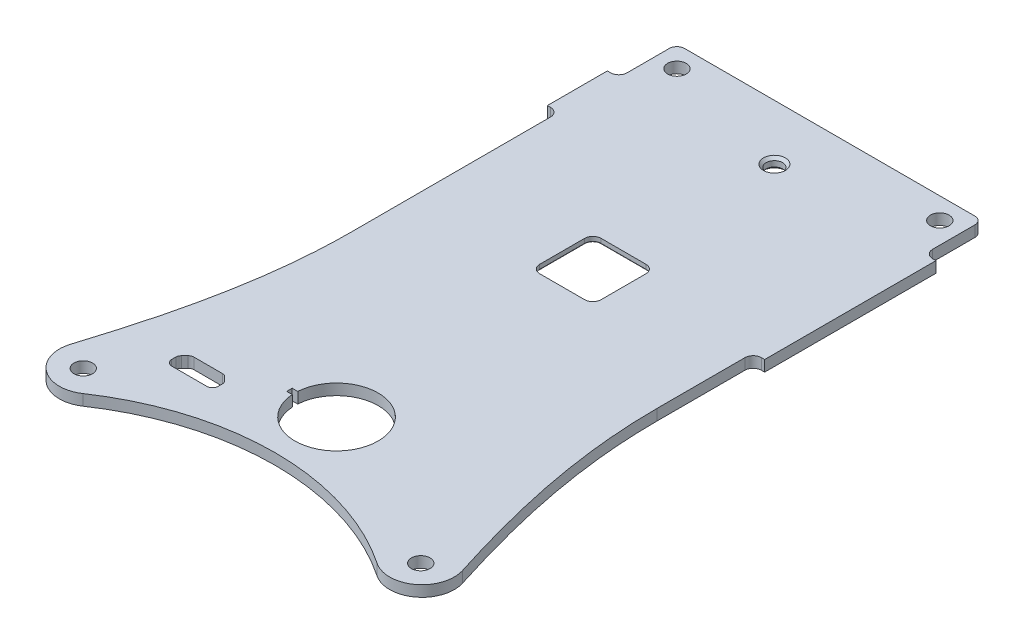
from build123d import *

# Parameters (mm, degrees)
VERT_ROD_W_VTULKA_1_START = 28
VERT_ROD_W_VTULKA_1_DEPTH = 2
HOLE_WIZARD_M32_D         = 3.4
HOLE_WIZARD_M32_DEPTH     = 2
HOLE_WIZARD_M32_TIP       = 1.021463052
HOLE_WIZARD_M33_D         = 3.4
HOLE_WIZARD_M33_DEPTH     = 2
HOLE_WIZARD_M33_TIP       = 1.021463052
HOLE_WIZARD_M34_D         = 3.4
HOLE_WIZARD_M34_DEPTH     = 2
HOLE_WIZARD_M34_TIP       = 1.021463052
HOLE_WIZARD_M35_D         = 3.4
HOLE_WIZARD_M35_DEPTH     = 2
HOLE_WIZARD_M35_TIP       = 1.021463052
HOLE_WIZARD_M36_D         = 3.4
HOLE_WIZARD_M36_DEPTH     = 2
HOLE_WIZARD_M36_TIP       = 1.021463052
HOLE_WIZARD_M37_D         = 3.4
HOLE_WIZARD_M37_DEPTH     = 2
HOLE_WIZARD_M37_TIP       = 1.021463052
HOLE_WIZARD_M38_D         = 3.4
HOLE_WIZARD_M38_DEPTH     = 2
HOLE_WIZARD_M38_TIP       = 1.021463052
HOLE_WIZARD_M39_D         = 3.4
HOLE_WIZARD_M39_DEPTH     = 2
HOLE_WIZARD_M39_TIP       = 1.021463052
HOLE_WIZARD_M310_D        = 3.4
HOLE_WIZARD_M310_DEPTH    = 2
HOLE_WIZARD_M310_TIP      = 1.021463052
HOLE_WIZARD_M311_D        = 3.4
HOLE_WIZARD_M311_DEPTH    = 2
HOLE_WIZARD_M311_TIP      = 1.021463052
SKETCH_25_W               = 2.1
SKETCH_25_H               = 31.28
EXTRUDE_1_DEPTH           = 2
HOLE_WIZARD_M313_D        = 3.4
HOLE_WIZARD_M313_DEPTH    = 2
HOLE_WIZARD_M313_TIP      = 1.021463052
HOLE_WIZARD_M314_D        = 3.4
HOLE_WIZARD_M314_DEPTH    = 2
HOLE_WIZARD_M314_TIP      = 1.021463052
HOLE_WIZARD_M315_D        = 3.4
HOLE_WIZARD_M315_DEPTH    = 2
HOLE_WIZARD_M315_TIP      = 1.021463052
HOLE_WIZARD_M316_D        = 3.4
HOLE_WIZARD_M316_DEPTH    = 2
HOLE_WIZARD_M316_TIP      = 1.021463052
HOLE_WIZARD_M317_D        = 3.4
HOLE_WIZARD_M317_DEPTH    = 2
HOLE_WIZARD_M317_TIP      = 1.021463052
HOLE_WIZARD_M318_D        = 3.4
HOLE_WIZARD_M318_DEPTH    = 2
HOLE_WIZARD_M318_TIP      = 1.021463052
HOLE_WIZARD_M319_D        = 3.4
HOLE_WIZARD_M319_DEPTH    = 2
HOLE_WIZARD_M319_TIP      = 1.021463052
HOLE_WIZARD_M320_D        = 3.4
HOLE_WIZARD_M320_DEPTH    = 2
HOLE_WIZARD_M320_TIP      = 1.021463052
HOLE_WIZARD_M321_D        = 3.4
HOLE_WIZARD_M321_DEPTH    = 2
HOLE_WIZARD_M321_TIP      = 1.021463052
HOLE_WIZARD_M323_D        = 3.4
HOLE_WIZARD_M323_DEPTH    = 2
HOLE_WIZARD_M323_TIP      = 1.021463052
HOLE_WIZARD_M324_D        = 3.4
HOLE_WIZARD_M324_DEPTH    = 2
HOLE_WIZARD_M324_TIP      = 1.021463052
HOLE_WIZARD_M325_D        = 3.4
HOLE_WIZARD_M325_DEPTH    = 2
HOLE_WIZARD_M325_TIP      = 1.021463052
HOLE_WIZARD_M326_D        = 3.4
HOLE_WIZARD_M326_DEPTH    = 2
HOLE_WIZARD_M326_TIP      = 1.021463052
HOLE_WIZARD_M327_D        = 3.4
HOLE_WIZARD_M327_DEPTH    = 2
HOLE_WIZARD_M327_TIP      = 1.021463052
HOLE_WIZARD_M328_D        = 3.4
HOLE_WIZARD_M328_DEPTH    = 2
HOLE_WIZARD_M328_TIP      = 1.021463052
HOLE_WIZARD_M329_D        = 3.4
HOLE_WIZARD_M329_DEPTH    = 2
HOLE_WIZARD_M329_TIP      = 1.021463052
FILLET_1_R                = 1.5
HOLE_WIZARD_M330_D        = 3.4
HOLE_WIZARD_M330_DEPTH    = 2
HOLE_WIZARD_M330_TIP      = 1.021463052
HOLE_WIZARD_M331_D        = 3.4
HOLE_WIZARD_M331_DEPTH    = 2
HOLE_WIZARD_M331_TIP      = 1.021463052
HOLE_WIZARD_M332_D        = 3.4
HOLE_WIZARD_M332_DEPTH    = 2
HOLE_WIZARD_M332_TIP      = 1.021463052
HOLE_WIZARD_M333_D        = 3.4
HOLE_WIZARD_M333_DEPTH    = 2
HOLE_WIZARD_M333_TIP      = 1.021463052
HOLE_WIZARD_M334_D        = 3.4
HOLE_WIZARD_M334_DEPTH    = 2
HOLE_WIZARD_M334_TIP      = 1.021463052
CUT_EXTRUDE_2_DEPTH       = 2
HOLE_WIZARD_M335_D        = 3.4
HOLE_WIZARD_M335_DEPTH    = 2
HOLE_WIZARD_M335_TIP      = 1.021463052
SKETCH_76_W               = 2.1
SKETCH_76_H               = 10.96
EXTRUDE_2_DEPTH           = 2
FILLET_2_R                = 1.5
HOLE_WIZARD_M336_D        = 3.4
HOLE_WIZARD_M336_DEPTH    = 2
HOLE_WIZARD_M336_TIP      = 1.021463052
HOLE_WIZARD_M337_D        = 3.4
HOLE_WIZARD_M337_DEPTH    = 2
HOLE_WIZARD_M337_TIP      = 1.021463052
HOLE_WIZARD_M338_D        = 3.4
HOLE_WIZARD_M338_DEPTH    = 2
HOLE_WIZARD_M338_TIP      = 1.021463052
HOLE_WIZARD_M339_D        = 3.4
HOLE_WIZARD_M339_DEPTH    = 2
HOLE_WIZARD_M339_TIP      = 1.021463052
HOLE_WIZARD_M340_D        = 3.4
HOLE_WIZARD_M340_DEPTH    = 2
HOLE_WIZARD_M340_TIP      = 1.021463052
HOLE_WIZARD_M341_D        = 3.4
HOLE_WIZARD_M341_DEPTH    = 2
HOLE_WIZARD_M341_TIP      = 1.021463052
HOLE_WIZARD_M342_D        = 3.4
HOLE_WIZARD_M342_DEPTH    = 2
HOLE_WIZARD_M342_TIP      = 1.021463052
HOLE_WIZARD_M343_D        = 3.4
HOLE_WIZARD_M343_DEPTH    = 2
HOLE_WIZARD_M343_TIP      = 1.021463052
HOLE_WIZARD_M344_D        = 3.4
HOLE_WIZARD_M344_DEPTH    = 2
HOLE_WIZARD_M344_TIP      = 1.021463052
HOLE_WIZARD_M345_D        = 3.4
HOLE_WIZARD_M345_DEPTH    = 2
HOLE_WIZARD_M345_TIP      = 1.021463052
HOLE_WIZARD_M346_D        = 3.4
HOLE_WIZARD_M346_DEPTH    = 2
HOLE_WIZARD_M346_TIP      = 1.021463052
HOLE_WIZARD_M347_D        = 3.4
HOLE_WIZARD_M347_DEPTH    = 2
HOLE_WIZARD_M347_TIP      = 1.021463052
HOLE_WIZARD_M348_D        = 3.4
HOLE_WIZARD_M348_DEPTH    = 2
HOLE_WIZARD_M348_TIP      = 1.021463052
HOLE_WIZARD_M349_D        = 3.4
HOLE_WIZARD_M349_DEPTH    = 2
HOLE_WIZARD_M349_TIP      = 1.021463052
HOLE_WIZARD_M350_D        = 3.4
HOLE_WIZARD_M350_DEPTH    = 2
HOLE_WIZARD_M350_TIP      = 1.021463052
HOLE_WIZARD_M351_D        = 3.4
HOLE_WIZARD_M351_DEPTH    = 2
HOLE_WIZARD_M351_TIP      = 1.021463052
HOLE_WIZARD_M352_D        = 3.4
HOLE_WIZARD_M352_DEPTH    = 2
HOLE_WIZARD_M352_TIP      = 1.021463052
HOLE_WIZARD_M353_D        = 3.4
HOLE_WIZARD_M353_DEPTH    = 2
HOLE_WIZARD_M353_TIP      = 1.021463052
HOLE_WIZARD_M354_D        = 3.4
HOLE_WIZARD_M354_DEPTH    = 2
HOLE_WIZARD_M354_TIP      = 1.021463052
HOLE_WIZARD_M355_D        = 3.4
HOLE_WIZARD_M355_DEPTH    = 2
HOLE_WIZARD_M355_TIP      = 1.021463052
HOLE_WIZARD_M356_D        = 3.4
HOLE_WIZARD_M356_DEPTH    = 2
HOLE_WIZARD_M356_TIP      = 1.021463052
HOLE_WIZARD_M357_D        = 3.4
HOLE_WIZARD_M357_DEPTH    = 2
HOLE_WIZARD_M357_TIP      = 1.021463052
HOLE_WIZARD_M358_D        = 3.4
HOLE_WIZARD_M358_DEPTH    = 2
HOLE_WIZARD_M358_TIP      = 1.021463052
SKETCH_123_R              = 7.6
CUT_EXTRUDE_3_DEPTH       = 121.787440724
SKETCH_124_W              = 2
SKETCH_124_H              = 1
CUT_EXTRUDE_4_DEPTH       = 121.787440724
CUT_EXTRUDE_5_DEPTH       = 121.787440724
HOLE_WIZARD_M359_D        = 3.4
HOLE_WIZARD_M359_DEPTH    = 2
HOLE_WIZARD_M359_TIP      = 1.021463052
FILLET_3_R                = 1.5
SKETCH_131_W              = 13.5
SKETCH_131_H              = 13.5
CUT_EXTRUDE_6_DEPTH       = 1.2
FILLET_4_R                = 1.5
SKETCH_132_R              = 1.5
CUT_EXTRUDE_7_DEPTH       = 121.787440724
CHAMFER_1_SIZE            = 0.5
HOLE_WIZARD_M360_D        = 3.4
HOLE_WIZARD_M360_DEPTH    = 2
HOLE_WIZARD_M360_TIP      = 1.021463052
CUT_EXTRUDE_8_DEPTH       = 121.787440724


# Read off the part's stored shape, not the designer's step: Припуск-Vert_rod_w_vtulka-1
with BuildPart() as part:
    # Припуск-Vert_rod_w_vtulka-1 outline → Припуск-Vert_rod_w_vtulka-1 (new body)
    with BuildSketch(Plane(origin=(0, 0, 0), x_dir=(1, 0, 0), z_dir=(0, 1, 0)).offset(VERT_ROD_W_VTULKA_1_START)):
        with BuildLine():
            Line((57.9, -50), (57.9, 9.4))
            Line((57.9, 9.4), (2.1, 9.4))
            Line((2.1, 9.4), (2.1, -50))
            add(Edge.make_bspline(
                [(2.1, -50), (2.099999708, -53.702093756), (1.892934302, -57.393018514), (1.115992256, -64.755298157), (0.549431015, -68.409554715), (-1.580606832, -79.306490561), (-3.568754299, -86.422318434), (-5.796769802, -93.474666863)],
                knots=[0, 0, 0, 0, 0.25, 0.25, 0.5, 0.5, 1, 1, 1, 1], degree=3))
            ThreePointArc((-5.796769802, -93.474666863), (-3.669922454, -99.944406822), (3.13868063, -100.099128581))
            ThreePointArc((3.13868063, -100.099128581), (30.000000814, -91.89999981), (56.86132072, -100.09912949))
            ThreePointArc((56.86132072, -100.09912949), (63.66953295, -99.944697708), (65.797056658, -93.475598404))
            add(Edge.make_bspline(
                [(65.797056658, -93.475598404), (64.681861992, -89.945689128), (63.625509471, -86.39851392), (61.715383372, -79.244721015), (60.863770171, -75.643731412), (59.444825005, -68.375684643), (58.880489881, -64.726556831), (58.107463811, -57.392195393), (57.9, -53.70670524), (57.9, -50)],
                knots=[0, 0, 0, 0, 0.25, 0.25, 0.5, 0.5, 0.75, 0.75, 1, 1, 1, 1], degree=3))
        make_face()
    extrude(amount=VERT_ROD_W_VTULKA_1_DEPTH)

    # Отверстие с зазором M32
    with Locations(Plane(origin=(-23.477702409, 30, -0.712313714), x_dir=(1, 0, 0), z_dir=(0, 1, 0))):
        with Locations((29.477702409, 4.787686286), (77.477702409, 4.787686286), (84.288969806, -96.800804138), (22.666435012, -96.800804138)):
            Hole(HOLE_WIZARD_M32_D / 2, depth=HOLE_WIZARD_M32_DEPTH)
            with Locations((0, 0, -(HOLE_WIZARD_M32_DEPTH + HOLE_WIZARD_M32_TIP / 2))):  # 118° drill point
                Cone(0, HOLE_WIZARD_M32_D / 2, HOLE_WIZARD_M32_TIP, mode=Mode.SUBTRACT)

    # Отверстие с зазором M33
    with Locations(Plane(origin=(-23.477702409, 30, -0.712313714), x_dir=(1, 0, 0), z_dir=(0, 1, 0))):
        with Locations((29.477702409, 4.787686286), (77.477702409, 4.787686286), (84.288969806, -96.800804138), (22.666435012, -96.800804138)):
            Hole(HOLE_WIZARD_M33_D / 2, depth=HOLE_WIZARD_M33_DEPTH)
            with Locations((0, 0, -(HOLE_WIZARD_M33_DEPTH + HOLE_WIZARD_M33_TIP / 2))):  # 118° drill point
                Cone(0, HOLE_WIZARD_M33_D / 2, HOLE_WIZARD_M33_TIP, mode=Mode.SUBTRACT)

    # Отверстие с зазором M34
    with Locations(Plane(origin=(-23.477702409, 30, -0.712313714), x_dir=(1, 0, 0), z_dir=(0, 1, 0))):
        with Locations((29.477702409, 4.787686286), (77.477702409, 4.787686286), (84.288969806, -96.800804138), (22.666435012, -96.800804138)):
            Hole(HOLE_WIZARD_M34_D / 2, depth=HOLE_WIZARD_M34_DEPTH)
            with Locations((0, 0, -(HOLE_WIZARD_M34_DEPTH + HOLE_WIZARD_M34_TIP / 2))):  # 118° drill point
                Cone(0, HOLE_WIZARD_M34_D / 2, HOLE_WIZARD_M34_TIP, mode=Mode.SUBTRACT)

    # Отверстие с зазором M35
    with Locations(Plane(origin=(-23.477702409, 30, -0.712313714), x_dir=(1, 0, 0), z_dir=(0, 1, 0))):
        with Locations((29.477702409, 4.787686286), (77.477702409, 4.787686286), (84.288969806, -96.800804138), (22.666435012, -96.800804138)):
            Hole(HOLE_WIZARD_M35_D / 2, depth=HOLE_WIZARD_M35_DEPTH)
            with Locations((0, 0, -(HOLE_WIZARD_M35_DEPTH + HOLE_WIZARD_M35_TIP / 2))):  # 118° drill point
                Cone(0, HOLE_WIZARD_M35_D / 2, HOLE_WIZARD_M35_TIP, mode=Mode.SUBTRACT)

    # Отверстие с зазором M36
    with Locations(Plane(origin=(-23.477702409, 30, -0.712313714), x_dir=(1, 0, 0), z_dir=(0, 1, 0))):
        with Locations((29.477702409, 4.787686286), (77.477702409, 4.787686286), (84.288969806, -96.800804138), (22.666435012, -96.800804138)):
            Hole(HOLE_WIZARD_M36_D / 2, depth=HOLE_WIZARD_M36_DEPTH)
            with Locations((0, 0, -(HOLE_WIZARD_M36_DEPTH + HOLE_WIZARD_M36_TIP / 2))):  # 118° drill point
                Cone(0, HOLE_WIZARD_M36_D / 2, HOLE_WIZARD_M36_TIP, mode=Mode.SUBTRACT)

    # Отверстие с зазором M37
    with Locations(Plane(origin=(-23.477702409, 30, -0.712313714), x_dir=(1, 0, 0), z_dir=(0, 1, 0))):
        with Locations((29.477702409, 4.787686286), (77.477702409, 4.787686286), (84.288969806, -96.800804138), (22.666435012, -96.800804138)):
            Hole(HOLE_WIZARD_M37_D / 2, depth=HOLE_WIZARD_M37_DEPTH)
            with Locations((0, 0, -(HOLE_WIZARD_M37_DEPTH + HOLE_WIZARD_M37_TIP / 2))):  # 118° drill point
                Cone(0, HOLE_WIZARD_M37_D / 2, HOLE_WIZARD_M37_TIP, mode=Mode.SUBTRACT)

    # Отверстие с зазором M38
    with Locations(Plane(origin=(-23.477702409, 30, -0.712313714), x_dir=(1, 0, 0), z_dir=(0, 1, 0))):
        with Locations((29.477702409, 4.787686286), (77.477702409, 4.787686286), (84.288969806, -96.800804138), (22.666435012, -96.800804138)):
            Hole(HOLE_WIZARD_M38_D / 2, depth=HOLE_WIZARD_M38_DEPTH)
            with Locations((0, 0, -(HOLE_WIZARD_M38_DEPTH + HOLE_WIZARD_M38_TIP / 2))):  # 118° drill point
                Cone(0, HOLE_WIZARD_M38_D / 2, HOLE_WIZARD_M38_TIP, mode=Mode.SUBTRACT)

    # Отверстие с зазором M39
    with Locations(Plane(origin=(-23.477702409, 30, -0.712313714), x_dir=(1, 0, 0), z_dir=(0, 1, 0))):
        with Locations((29.477702409, 4.787686286), (77.477702409, 4.787686286), (84.288969806, -96.800804138), (22.666435012, -96.800804138)):
            Hole(HOLE_WIZARD_M39_D / 2, depth=HOLE_WIZARD_M39_DEPTH)
            with Locations((0, 0, -(HOLE_WIZARD_M39_DEPTH + HOLE_WIZARD_M39_TIP / 2))):  # 118° drill point
                Cone(0, HOLE_WIZARD_M39_D / 2, HOLE_WIZARD_M39_TIP, mode=Mode.SUBTRACT)

    # Отверстие с зазором M310
    with Locations(Plane(origin=(-23.477702409, 30, -0.712313714), x_dir=(1, 0, 0), z_dir=(0, 1, 0))):
        with Locations((29.477702409, 4.787686286), (77.477702409, 4.787686286), (84.288969806, -96.800804138), (22.666435012, -96.800804138)):
            Hole(HOLE_WIZARD_M310_D / 2, depth=HOLE_WIZARD_M310_DEPTH)
            with Locations((0, 0, -(HOLE_WIZARD_M310_DEPTH + HOLE_WIZARD_M310_TIP / 2))):  # 118° drill point
                Cone(0, HOLE_WIZARD_M310_D / 2, HOLE_WIZARD_M310_TIP, mode=Mode.SUBTRACT)

    # Отверстие с зазором M311
    with Locations(Plane(origin=(-23.477702409, 30, -0.712313714), x_dir=(1, 0, 0), z_dir=(0, 1, 0))):
        with Locations((29.477702409, 4.787686286), (77.477702409, 4.787686286), (84.288969806, -96.800804138), (22.666435012, -96.800804138)):
            Hole(HOLE_WIZARD_M311_D / 2, depth=HOLE_WIZARD_M311_DEPTH)
            with Locations((0, 0, -(HOLE_WIZARD_M311_DEPTH + HOLE_WIZARD_M311_TIP / 2))):  # 118° drill point
                Cone(0, HOLE_WIZARD_M311_D / 2, HOLE_WIZARD_M311_TIP, mode=Mode.SUBTRACT)

    # Эскиз25 → Бобышка-Вытянуть1 (add)
    with BuildSketch(Plane(origin=(0, 30, 0), x_dir=(1, 0, 0), z_dir=(0, 1, 0))):
        with Locations((58.95, -16.84)):
            Rectangle(SKETCH_25_W, SKETCH_25_H)
    extrude(amount=-EXTRUDE_1_DEPTH)

    # Отверстие с зазором M313
    with Locations(Plane(origin=(-23.477702409, 30, -0.712313714), x_dir=(1, 0, 0), z_dir=(0, 1, 0))):
        with Locations((29.477702409, 4.787686286), (77.477702409, 4.787686286), (84.288969806, -96.800804138), (22.666435012, -96.800804138)):
            Hole(HOLE_WIZARD_M313_D / 2, depth=HOLE_WIZARD_M313_DEPTH)
            with Locations((0, 0, -(HOLE_WIZARD_M313_DEPTH + HOLE_WIZARD_M313_TIP / 2))):  # 118° drill point
                Cone(0, HOLE_WIZARD_M313_D / 2, HOLE_WIZARD_M313_TIP, mode=Mode.SUBTRACT)

    # Отверстие с зазором M314
    with Locations(Plane(origin=(-23.477702409, 30, -0.712313714), x_dir=(1, 0, 0), z_dir=(0, 1, 0))):
        with Locations((29.477702409, 4.787686286), (77.477702409, 4.787686286), (84.288969806, -96.800804138), (22.666435012, -96.800804138)):
            Hole(HOLE_WIZARD_M314_D / 2, depth=HOLE_WIZARD_M314_DEPTH)
            with Locations((0, 0, -(HOLE_WIZARD_M314_DEPTH + HOLE_WIZARD_M314_TIP / 2))):  # 118° drill point
                Cone(0, HOLE_WIZARD_M314_D / 2, HOLE_WIZARD_M314_TIP, mode=Mode.SUBTRACT)

    # Отверстие с зазором M315
    with Locations(Plane(origin=(-23.477702409, 30, -0.712313714), x_dir=(1, 0, 0), z_dir=(0, 1, 0))):
        with Locations((29.477702409, 4.787686286), (77.477702409, 4.787686286), (84.288969806, -96.800804138), (22.666435012, -96.800804138)):
            Hole(HOLE_WIZARD_M315_D / 2, depth=HOLE_WIZARD_M315_DEPTH)
            with Locations((0, 0, -(HOLE_WIZARD_M315_DEPTH + HOLE_WIZARD_M315_TIP / 2))):  # 118° drill point
                Cone(0, HOLE_WIZARD_M315_D / 2, HOLE_WIZARD_M315_TIP, mode=Mode.SUBTRACT)

    # Отверстие с зазором M316
    with Locations(Plane(origin=(-23.477702409, 30, -0.712313714), x_dir=(1, 0, 0), z_dir=(0, 1, 0))):
        with Locations((29.477702409, 4.787686286), (77.477702409, 4.787686286), (84.288969806, -96.800804138), (22.666435012, -96.800804138)):
            Hole(HOLE_WIZARD_M316_D / 2, depth=HOLE_WIZARD_M316_DEPTH)
            with Locations((0, 0, -(HOLE_WIZARD_M316_DEPTH + HOLE_WIZARD_M316_TIP / 2))):  # 118° drill point
                Cone(0, HOLE_WIZARD_M316_D / 2, HOLE_WIZARD_M316_TIP, mode=Mode.SUBTRACT)

    # Отверстие с зазором M317
    with Locations(Plane(origin=(-23.477702409, 30, -0.712313714), x_dir=(1, 0, 0), z_dir=(0, 1, 0))):
        with Locations((29.477702409, 4.787686286), (77.477702409, 4.787686286), (84.288969806, -96.800804138), (22.666435012, -96.800804138)):
            Hole(HOLE_WIZARD_M317_D / 2, depth=HOLE_WIZARD_M317_DEPTH)
            with Locations((0, 0, -(HOLE_WIZARD_M317_DEPTH + HOLE_WIZARD_M317_TIP / 2))):  # 118° drill point
                Cone(0, HOLE_WIZARD_M317_D / 2, HOLE_WIZARD_M317_TIP, mode=Mode.SUBTRACT)

    # Отверстие с зазором M318
    with Locations(Plane(origin=(-23.477702409, 30, -0.712313714), x_dir=(1, 0, 0), z_dir=(0, 1, 0))):
        with Locations((29.477702409, 4.787686286), (77.477702409, 4.787686286), (84.288969806, -96.800804138), (22.666435012, -96.800804138)):
            Hole(HOLE_WIZARD_M318_D / 2, depth=HOLE_WIZARD_M318_DEPTH)
            with Locations((0, 0, -(HOLE_WIZARD_M318_DEPTH + HOLE_WIZARD_M318_TIP / 2))):  # 118° drill point
                Cone(0, HOLE_WIZARD_M318_D / 2, HOLE_WIZARD_M318_TIP, mode=Mode.SUBTRACT)

    # Отверстие с зазором M319
    with Locations(Plane(origin=(-23.477702409, 30, -0.712313714), x_dir=(1, 0, 0), z_dir=(0, 1, 0))):
        with Locations((29.477702409, 4.787686286), (77.477702409, 4.787686286), (84.288969806, -96.800804138), (22.666435012, -96.800804138)):
            Hole(HOLE_WIZARD_M319_D / 2, depth=HOLE_WIZARD_M319_DEPTH)
            with Locations((0, 0, -(HOLE_WIZARD_M319_DEPTH + HOLE_WIZARD_M319_TIP / 2))):  # 118° drill point
                Cone(0, HOLE_WIZARD_M319_D / 2, HOLE_WIZARD_M319_TIP, mode=Mode.SUBTRACT)

    # Отверстие с зазором M320
    with Locations(Plane(origin=(-23.477702409, 30, -0.712313714), x_dir=(1, 0, 0), z_dir=(0, 1, 0))):
        with Locations((29.477702409, 4.787686286), (77.477702409, 4.787686286), (84.288969806, -96.800804138), (22.666435012, -96.800804138)):
            Hole(HOLE_WIZARD_M320_D / 2, depth=HOLE_WIZARD_M320_DEPTH)
            with Locations((0, 0, -(HOLE_WIZARD_M320_DEPTH + HOLE_WIZARD_M320_TIP / 2))):  # 118° drill point
                Cone(0, HOLE_WIZARD_M320_D / 2, HOLE_WIZARD_M320_TIP, mode=Mode.SUBTRACT)

    # Отверстие с зазором M321
    with Locations(Plane(origin=(-23.477702409, 30, -0.712313714), x_dir=(1, 0, 0), z_dir=(0, 1, 0))):
        with Locations((29.477702409, 4.787686286), (77.477702409, 4.787686286), (84.288969806, -96.800804138), (22.666435012, -96.800804138)):
            Hole(HOLE_WIZARD_M321_D / 2, depth=HOLE_WIZARD_M321_DEPTH)
            with Locations((0, 0, -(HOLE_WIZARD_M321_DEPTH + HOLE_WIZARD_M321_TIP / 2))):  # 118° drill point
                Cone(0, HOLE_WIZARD_M321_D / 2, HOLE_WIZARD_M321_TIP, mode=Mode.SUBTRACT)

    # Отверстие с зазором M323
    with Locations(Plane(origin=(-23.477702409, 30, -0.712313714), x_dir=(1, 0, 0), z_dir=(0, 1, 0))):
        with Locations((29.477702409, 4.787686286), (77.477702409, 4.787686286), (84.288969806, -96.800804138), (22.666435012, -96.800804138)):
            Hole(HOLE_WIZARD_M323_D / 2, depth=HOLE_WIZARD_M323_DEPTH)
            with Locations((0, 0, -(HOLE_WIZARD_M323_DEPTH + HOLE_WIZARD_M323_TIP / 2))):  # 118° drill point
                Cone(0, HOLE_WIZARD_M323_D / 2, HOLE_WIZARD_M323_TIP, mode=Mode.SUBTRACT)

    # Отверстие с зазором M324
    with Locations(Plane(origin=(-23.477702409, 30, -0.712313714), x_dir=(1, 0, 0), z_dir=(0, 1, 0))):
        with Locations((29.477702409, 4.787686286), (77.477702409, 4.787686286), (84.288969806, -96.800804138), (22.666435012, -96.800804138)):
            Hole(HOLE_WIZARD_M324_D / 2, depth=HOLE_WIZARD_M324_DEPTH)
            with Locations((0, 0, -(HOLE_WIZARD_M324_DEPTH + HOLE_WIZARD_M324_TIP / 2))):  # 118° drill point
                Cone(0, HOLE_WIZARD_M324_D / 2, HOLE_WIZARD_M324_TIP, mode=Mode.SUBTRACT)

    # Отверстие с зазором M325
    with Locations(Plane(origin=(-23.477702409, 30, -0.712313714), x_dir=(1, 0, 0), z_dir=(0, 1, 0))):
        with Locations((29.477702409, 4.787686286), (77.477702409, 4.787686286), (84.288969806, -96.800804138), (22.666435012, -96.800804138)):
            Hole(HOLE_WIZARD_M325_D / 2, depth=HOLE_WIZARD_M325_DEPTH)
            with Locations((0, 0, -(HOLE_WIZARD_M325_DEPTH + HOLE_WIZARD_M325_TIP / 2))):  # 118° drill point
                Cone(0, HOLE_WIZARD_M325_D / 2, HOLE_WIZARD_M325_TIP, mode=Mode.SUBTRACT)

    # Отверстие с зазором M326
    with Locations(Plane(origin=(-23.477702409, 30, -0.712313714), x_dir=(1, 0, 0), z_dir=(0, 1, 0))):
        with Locations((29.477702409, 4.787686286), (77.477702409, 4.787686286), (84.288969806, -96.800804138), (22.666435012, -96.800804138)):
            Hole(HOLE_WIZARD_M326_D / 2, depth=HOLE_WIZARD_M326_DEPTH)
            with Locations((0, 0, -(HOLE_WIZARD_M326_DEPTH + HOLE_WIZARD_M326_TIP / 2))):  # 118° drill point
                Cone(0, HOLE_WIZARD_M326_D / 2, HOLE_WIZARD_M326_TIP, mode=Mode.SUBTRACT)

    # Отверстие с зазором M327
    with Locations(Plane(origin=(-23.477702409, 30, -0.712313714), x_dir=(1, 0, 0), z_dir=(0, 1, 0))):
        with Locations((29.477702409, 4.787686286), (77.477702409, 4.787686286), (84.288969806, -96.800804138), (22.666435012, -96.800804138)):
            Hole(HOLE_WIZARD_M327_D / 2, depth=HOLE_WIZARD_M327_DEPTH)
            with Locations((0, 0, -(HOLE_WIZARD_M327_DEPTH + HOLE_WIZARD_M327_TIP / 2))):  # 118° drill point
                Cone(0, HOLE_WIZARD_M327_D / 2, HOLE_WIZARD_M327_TIP, mode=Mode.SUBTRACT)

    # Отверстие с зазором M328
    with Locations(Plane(origin=(-23.477702409, 30, -0.712313714), x_dir=(1, 0, 0), z_dir=(0, 1, 0))):
        with Locations((29.477702409, 4.787686286), (77.477702409, 4.787686286), (84.288969806, -96.800804138), (22.666435012, -96.800804138)):
            Hole(HOLE_WIZARD_M328_D / 2, depth=HOLE_WIZARD_M328_DEPTH)
            with Locations((0, 0, -(HOLE_WIZARD_M328_DEPTH + HOLE_WIZARD_M328_TIP / 2))):  # 118° drill point
                Cone(0, HOLE_WIZARD_M328_D / 2, HOLE_WIZARD_M328_TIP, mode=Mode.SUBTRACT)

    # Отверстие с зазором M329
    with Locations(Plane(origin=(-23.477702409, 30, -0.712313714), x_dir=(1, 0, 0), z_dir=(0, 1, 0))):
        with Locations((29.477702409, 4.787686286), (77.477702409, 4.787686286), (84.288969806, -96.800804138), (22.666435012, -96.800804138)):
            Hole(HOLE_WIZARD_M329_D / 2, depth=HOLE_WIZARD_M329_DEPTH)
            with Locations((0, 0, -(HOLE_WIZARD_M329_DEPTH + HOLE_WIZARD_M329_TIP / 2))):  # 118° drill point
                Cone(0, HOLE_WIZARD_M329_D / 2, HOLE_WIZARD_M329_TIP, mode=Mode.SUBTRACT)

    # Скругление1
    fillet_1_edges = [part.edges().sort_by_distance(p)[0] for p in [
        (57.9, 29, 32.48),
        (57.9, 29, 1.2),
    ]]
    fillet(fillet_1_edges, radius=FILLET_1_R)

    # Отверстие с зазором M330
    with Locations(Plane(origin=(-23.477702409, 30, -0.712313714), x_dir=(1, 0, 0), z_dir=(0, 1, 0))):
        with Locations((29.477702409, 4.787686286), (77.477702409, 4.787686286), (84.288969806, -96.800804138), (22.666435012, -96.800804138)):
            Hole(HOLE_WIZARD_M330_D / 2, depth=HOLE_WIZARD_M330_DEPTH)
            with Locations((0, 0, -(HOLE_WIZARD_M330_DEPTH + HOLE_WIZARD_M330_TIP / 2))):  # 118° drill point
                Cone(0, HOLE_WIZARD_M330_D / 2, HOLE_WIZARD_M330_TIP, mode=Mode.SUBTRACT)

    # Отверстие с зазором M331
    with Locations(Plane(origin=(-23.477702409, 30, -0.712313714), x_dir=(1, 0, 0), z_dir=(0, 1, 0))):
        with Locations((29.477702409, 4.787686286), (77.477702409, 4.787686286), (84.288969806, -96.800804138), (22.666435012, -96.800804138)):
            Hole(HOLE_WIZARD_M331_D / 2, depth=HOLE_WIZARD_M331_DEPTH)
            with Locations((0, 0, -(HOLE_WIZARD_M331_DEPTH + HOLE_WIZARD_M331_TIP / 2))):  # 118° drill point
                Cone(0, HOLE_WIZARD_M331_D / 2, HOLE_WIZARD_M331_TIP, mode=Mode.SUBTRACT)

    # Отверстие с зазором M332
    with Locations(Plane(origin=(-23.477702409, 30, -0.712313714), x_dir=(1, 0, 0), z_dir=(0, 1, 0))):
        with Locations((29.477702409, 4.787686286), (77.477702409, 4.787686286), (84.288969806, -96.800804138), (22.666435012, -96.800804138)):
            Hole(HOLE_WIZARD_M332_D / 2, depth=HOLE_WIZARD_M332_DEPTH)
            with Locations((0, 0, -(HOLE_WIZARD_M332_DEPTH + HOLE_WIZARD_M332_TIP / 2))):  # 118° drill point
                Cone(0, HOLE_WIZARD_M332_D / 2, HOLE_WIZARD_M332_TIP, mode=Mode.SUBTRACT)

    # Отверстие с зазором M333
    with Locations(Plane(origin=(-23.477702409, 30, -0.712313714), x_dir=(1, 0, 0), z_dir=(0, 1, 0))):
        with Locations((29.477702409, 4.787686286), (77.477702409, 4.787686286), (84.288969806, -96.800804138), (22.666435012, -96.800804138)):
            Hole(HOLE_WIZARD_M333_D / 2, depth=HOLE_WIZARD_M333_DEPTH)
            with Locations((0, 0, -(HOLE_WIZARD_M333_DEPTH + HOLE_WIZARD_M333_TIP / 2))):  # 118° drill point
                Cone(0, HOLE_WIZARD_M333_D / 2, HOLE_WIZARD_M333_TIP, mode=Mode.SUBTRACT)

    # Отверстие с зазором M334
    with Locations(Plane(origin=(-23.477702409, 30, -0.712313714), x_dir=(1, 0, 0), z_dir=(0, 1, 0))):
        with Locations((29.477702409, 4.787686286), (77.477702409, 4.787686286), (84.288969806, -96.800804138), (22.666435012, -96.800804138)):
            Hole(HOLE_WIZARD_M334_D / 2, depth=HOLE_WIZARD_M334_DEPTH)
            with Locations((0, 0, -(HOLE_WIZARD_M334_DEPTH + HOLE_WIZARD_M334_TIP / 2))):  # 118° drill point
                Cone(0, HOLE_WIZARD_M334_D / 2, HOLE_WIZARD_M334_TIP, mode=Mode.SUBTRACT)

    # Эскиз73 → Вырез-Вытянуть2 (cut)
    with BuildSketch(Plane(origin=(0, 30, 0), x_dir=(1, 0, 0), z_dir=(0, 1, 0))):
        with BuildLine():
            Line((57.9, 9.4), (56.5, 9.4))
            ThreePointArc((56.5, 9.4), (57.489949494, 8.989949494), (57.9, 8))
            Line((57.9, 8), (57.9, 9.4))
        make_face()
        with BuildLine():
            Line((2.1, 9.4), (2.1, 8))
            ThreePointArc((2.1, 8), (2.510050506, 8.989949494), (3.5, 9.4))
            Line((3.5, 9.4), (2.1, 9.4))
        make_face()
    extrude(amount=-CUT_EXTRUDE_2_DEPTH, mode=Mode.SUBTRACT)

    # Отверстие с зазором M335
    with Locations(Plane(origin=(-23.477702409, 30, -0.712313714), x_dir=(1, 0, 0), z_dir=(0, 1, 0))):
        with Locations((29.477702409, 4.787686286), (77.477702409, 4.787686286), (84.288969806, -96.800804138), (22.666435012, -96.800804138)):
            Hole(HOLE_WIZARD_M335_D / 2, depth=HOLE_WIZARD_M335_DEPTH)
            with Locations((0, 0, -(HOLE_WIZARD_M335_DEPTH + HOLE_WIZARD_M335_TIP / 2))):  # 118° drill point
                Cone(0, HOLE_WIZARD_M335_D / 2, HOLE_WIZARD_M335_TIP, mode=Mode.SUBTRACT)

    # Эскиз76 → Бобышка-Вытянуть2 (add)
    with BuildSketch(Plane(origin=(0, 30, 0), x_dir=(1, 0, 0), z_dir=(0, 1, 0))):
        with Locations((1.05, -6.68)):
            Rectangle(SKETCH_76_W, SKETCH_76_H)
    extrude(amount=-EXTRUDE_2_DEPTH)

    # Скругление2
    fillet_2_edges = [part.edges().sort_by_distance(p)[0] for p in [
        (2.1, 29, 12.16),
        (2.1, 29, 1.2),
    ]]
    fillet(fillet_2_edges, radius=FILLET_2_R)

    # Отверстие с зазором M336
    with Locations(Plane(origin=(-23.477702409, 30, -0.712313714), x_dir=(1, 0, 0), z_dir=(0, 1, 0))):
        with Locations((29.477702409, 4.787686286), (77.477702409, 4.787686286), (84.288969806, -96.800804138), (22.666435012, -96.800804138)):
            Hole(HOLE_WIZARD_M336_D / 2, depth=HOLE_WIZARD_M336_DEPTH)
            with Locations((0, 0, -(HOLE_WIZARD_M336_DEPTH + HOLE_WIZARD_M336_TIP / 2))):  # 118° drill point
                Cone(0, HOLE_WIZARD_M336_D / 2, HOLE_WIZARD_M336_TIP, mode=Mode.SUBTRACT)

    # Отверстие с зазором M337
    with Locations(Plane(origin=(-23.477702409, 30, -0.712313714), x_dir=(1, 0, 0), z_dir=(0, 1, 0))):
        with Locations((29.477702409, 4.787686286), (77.477702409, 4.787686286), (84.288969806, -96.800804138), (22.666435012, -96.800804138)):
            Hole(HOLE_WIZARD_M337_D / 2, depth=HOLE_WIZARD_M337_DEPTH)
            with Locations((0, 0, -(HOLE_WIZARD_M337_DEPTH + HOLE_WIZARD_M337_TIP / 2))):  # 118° drill point
                Cone(0, HOLE_WIZARD_M337_D / 2, HOLE_WIZARD_M337_TIP, mode=Mode.SUBTRACT)

    # Отверстие с зазором M338
    with Locations(Plane(origin=(-23.477702409, 30, -0.712313714), x_dir=(1, 0, 0), z_dir=(0, 1, 0))):
        with Locations((29.477702409, 4.787686286), (77.477702409, 4.787686286), (84.288969806, -96.800804138), (22.666435012, -96.800804138)):
            Hole(HOLE_WIZARD_M338_D / 2, depth=HOLE_WIZARD_M338_DEPTH)
            with Locations((0, 0, -(HOLE_WIZARD_M338_DEPTH + HOLE_WIZARD_M338_TIP / 2))):  # 118° drill point
                Cone(0, HOLE_WIZARD_M338_D / 2, HOLE_WIZARD_M338_TIP, mode=Mode.SUBTRACT)

    # Отверстие с зазором M339
    with Locations(Plane(origin=(-23.477702409, 30, -0.712313714), x_dir=(1, 0, 0), z_dir=(0, 1, 0))):
        with Locations((29.477702409, 4.787686286), (77.477702409, 4.787686286), (84.288969806, -96.800804138), (22.666435012, -96.800804138)):
            Hole(HOLE_WIZARD_M339_D / 2, depth=HOLE_WIZARD_M339_DEPTH)
            with Locations((0, 0, -(HOLE_WIZARD_M339_DEPTH + HOLE_WIZARD_M339_TIP / 2))):  # 118° drill point
                Cone(0, HOLE_WIZARD_M339_D / 2, HOLE_WIZARD_M339_TIP, mode=Mode.SUBTRACT)

    # Отверстие с зазором M340
    with Locations(Plane(origin=(-23.477702409, 30, -0.712313714), x_dir=(1, 0, 0), z_dir=(0, 1, 0))):
        with Locations((29.477702409, 4.787686286), (77.477702409, 4.787686286), (84.288969806, -96.800804138), (22.666435012, -96.800804138)):
            Hole(HOLE_WIZARD_M340_D / 2, depth=HOLE_WIZARD_M340_DEPTH)
            with Locations((0, 0, -(HOLE_WIZARD_M340_DEPTH + HOLE_WIZARD_M340_TIP / 2))):  # 118° drill point
                Cone(0, HOLE_WIZARD_M340_D / 2, HOLE_WIZARD_M340_TIP, mode=Mode.SUBTRACT)

    # Отверстие с зазором M341
    with Locations(Plane(origin=(-23.477702409, 30, -0.712313714), x_dir=(1, 0, 0), z_dir=(0, 1, 0))):
        with Locations((29.477702409, 4.787686286), (77.477702409, 4.787686286), (84.288969806, -96.800804138), (22.666435012, -96.800804138)):
            Hole(HOLE_WIZARD_M341_D / 2, depth=HOLE_WIZARD_M341_DEPTH)
            with Locations((0, 0, -(HOLE_WIZARD_M341_DEPTH + HOLE_WIZARD_M341_TIP / 2))):  # 118° drill point
                Cone(0, HOLE_WIZARD_M341_D / 2, HOLE_WIZARD_M341_TIP, mode=Mode.SUBTRACT)

    # Отверстие с зазором M342
    with Locations(Plane(origin=(-23.477702409, 30, -0.712313714), x_dir=(1, 0, 0), z_dir=(0, 1, 0))):
        with Locations((29.477702409, 4.787686286), (77.477702409, 4.787686286), (84.288969806, -96.800804138), (22.666435012, -96.800804138)):
            Hole(HOLE_WIZARD_M342_D / 2, depth=HOLE_WIZARD_M342_DEPTH)
            with Locations((0, 0, -(HOLE_WIZARD_M342_DEPTH + HOLE_WIZARD_M342_TIP / 2))):  # 118° drill point
                Cone(0, HOLE_WIZARD_M342_D / 2, HOLE_WIZARD_M342_TIP, mode=Mode.SUBTRACT)

    # Отверстие с зазором M343
    with Locations(Plane(origin=(-23.477702409, 30, -0.712313714), x_dir=(1, 0, 0), z_dir=(0, 1, 0))):
        with Locations((29.477702409, 4.787686286), (77.477702409, 4.787686286), (84.288969806, -96.800804138), (22.666435012, -96.800804138)):
            Hole(HOLE_WIZARD_M343_D / 2, depth=HOLE_WIZARD_M343_DEPTH)
            with Locations((0, 0, -(HOLE_WIZARD_M343_DEPTH + HOLE_WIZARD_M343_TIP / 2))):  # 118° drill point
                Cone(0, HOLE_WIZARD_M343_D / 2, HOLE_WIZARD_M343_TIP, mode=Mode.SUBTRACT)

    # Отверстие с зазором M344
    with Locations(Plane(origin=(-23.477702409, 30, -0.712313714), x_dir=(1, 0, 0), z_dir=(0, 1, 0))):
        with Locations((29.477702409, 4.787686286), (77.477702409, 4.787686286), (84.288969806, -96.800804138), (22.666435012, -96.800804138)):
            Hole(HOLE_WIZARD_M344_D / 2, depth=HOLE_WIZARD_M344_DEPTH)
            with Locations((0, 0, -(HOLE_WIZARD_M344_DEPTH + HOLE_WIZARD_M344_TIP / 2))):  # 118° drill point
                Cone(0, HOLE_WIZARD_M344_D / 2, HOLE_WIZARD_M344_TIP, mode=Mode.SUBTRACT)

    # Отверстие с зазором M345
    with Locations(Plane(origin=(-23.477702409, 30, -0.712313714), x_dir=(1, 0, 0), z_dir=(0, 1, 0))):
        with Locations((29.477702409, 4.787686286), (77.477702409, 4.787686286), (84.288969806, -96.800804138), (22.666435012, -96.800804138)):
            Hole(HOLE_WIZARD_M345_D / 2, depth=HOLE_WIZARD_M345_DEPTH)
            with Locations((0, 0, -(HOLE_WIZARD_M345_DEPTH + HOLE_WIZARD_M345_TIP / 2))):  # 118° drill point
                Cone(0, HOLE_WIZARD_M345_D / 2, HOLE_WIZARD_M345_TIP, mode=Mode.SUBTRACT)

    # Отверстие с зазором M346
    with Locations(Plane(origin=(-23.477702409, 30, -0.712313714), x_dir=(1, 0, 0), z_dir=(0, 1, 0))):
        with Locations((29.477702409, 4.787686286), (77.477702409, 4.787686286), (84.288969806, -96.800804138), (22.666435012, -96.800804138)):
            Hole(HOLE_WIZARD_M346_D / 2, depth=HOLE_WIZARD_M346_DEPTH)
            with Locations((0, 0, -(HOLE_WIZARD_M346_DEPTH + HOLE_WIZARD_M346_TIP / 2))):  # 118° drill point
                Cone(0, HOLE_WIZARD_M346_D / 2, HOLE_WIZARD_M346_TIP, mode=Mode.SUBTRACT)

    # Отверстие с зазором M347
    with Locations(Plane(origin=(-23.477702409, 30, -0.712313714), x_dir=(1, 0, 0), z_dir=(0, 1, 0))):
        with Locations((29.477702409, 4.787686286), (77.477702409, 4.787686286), (84.288969806, -96.800804138), (22.666435012, -96.800804138)):
            Hole(HOLE_WIZARD_M347_D / 2, depth=HOLE_WIZARD_M347_DEPTH)
            with Locations((0, 0, -(HOLE_WIZARD_M347_DEPTH + HOLE_WIZARD_M347_TIP / 2))):  # 118° drill point
                Cone(0, HOLE_WIZARD_M347_D / 2, HOLE_WIZARD_M347_TIP, mode=Mode.SUBTRACT)

    # Отверстие с зазором M348
    with Locations(Plane(origin=(-23.477702409, 30, -0.712313714), x_dir=(1, 0, 0), z_dir=(0, 1, 0))):
        with Locations((29.477702409, 4.787686286), (77.477702409, 4.787686286), (84.288969806, -96.800804138), (22.666435012, -96.800804138)):
            Hole(HOLE_WIZARD_M348_D / 2, depth=HOLE_WIZARD_M348_DEPTH)
            with Locations((0, 0, -(HOLE_WIZARD_M348_DEPTH + HOLE_WIZARD_M348_TIP / 2))):  # 118° drill point
                Cone(0, HOLE_WIZARD_M348_D / 2, HOLE_WIZARD_M348_TIP, mode=Mode.SUBTRACT)

    # Отверстие с зазором M349
    with Locations(Plane(origin=(-23.477702409, 30, -0.712313714), x_dir=(1, 0, 0), z_dir=(0, 1, 0))):
        with Locations((29.477702409, 4.787686286), (77.477702409, 4.787686286), (84.288969806, -96.800804138), (22.666435012, -96.800804138)):
            Hole(HOLE_WIZARD_M349_D / 2, depth=HOLE_WIZARD_M349_DEPTH)
            with Locations((0, 0, -(HOLE_WIZARD_M349_DEPTH + HOLE_WIZARD_M349_TIP / 2))):  # 118° drill point
                Cone(0, HOLE_WIZARD_M349_D / 2, HOLE_WIZARD_M349_TIP, mode=Mode.SUBTRACT)

    # Отверстие с зазором M350
    with Locations(Plane(origin=(-23.477702409, 30, -0.712313714), x_dir=(1, 0, 0), z_dir=(0, 1, 0))):
        with Locations((29.477702409, 4.787686286), (77.477702409, 4.787686286), (84.288969806, -96.800804138), (22.666435012, -96.800804138)):
            Hole(HOLE_WIZARD_M350_D / 2, depth=HOLE_WIZARD_M350_DEPTH)
            with Locations((0, 0, -(HOLE_WIZARD_M350_DEPTH + HOLE_WIZARD_M350_TIP / 2))):  # 118° drill point
                Cone(0, HOLE_WIZARD_M350_D / 2, HOLE_WIZARD_M350_TIP, mode=Mode.SUBTRACT)

    # Отверстие с зазором M351
    with Locations(Plane(origin=(-23.477702409, 30, -0.712313714), x_dir=(1, 0, 0), z_dir=(0, 1, 0))):
        with Locations((29.477702409, 4.787686286), (77.477702409, 4.787686286), (84.288969806, -96.800804138), (22.666435012, -96.800804138)):
            Hole(HOLE_WIZARD_M351_D / 2, depth=HOLE_WIZARD_M351_DEPTH)
            with Locations((0, 0, -(HOLE_WIZARD_M351_DEPTH + HOLE_WIZARD_M351_TIP / 2))):  # 118° drill point
                Cone(0, HOLE_WIZARD_M351_D / 2, HOLE_WIZARD_M351_TIP, mode=Mode.SUBTRACT)

    # Отверстие с зазором M352
    with Locations(Plane(origin=(-23.477702409, 30, -0.712313714), x_dir=(1, 0, 0), z_dir=(0, 1, 0))):
        with Locations((29.477702409, 4.787686286), (77.477702409, 4.787686286), (84.288969806, -96.800804138), (22.666435012, -96.800804138)):
            Hole(HOLE_WIZARD_M352_D / 2, depth=HOLE_WIZARD_M352_DEPTH)
            with Locations((0, 0, -(HOLE_WIZARD_M352_DEPTH + HOLE_WIZARD_M352_TIP / 2))):  # 118° drill point
                Cone(0, HOLE_WIZARD_M352_D / 2, HOLE_WIZARD_M352_TIP, mode=Mode.SUBTRACT)

    # Отверстие с зазором M353
    with Locations(Plane(origin=(-23.477702409, 30, -0.712313714), x_dir=(1, 0, 0), z_dir=(0, 1, 0))):
        with Locations((29.477702409, 4.787686286), (77.477702409, 4.787686286), (84.288969806, -96.800804138), (22.666435012, -96.800804138)):
            Hole(HOLE_WIZARD_M353_D / 2, depth=HOLE_WIZARD_M353_DEPTH)
            with Locations((0, 0, -(HOLE_WIZARD_M353_DEPTH + HOLE_WIZARD_M353_TIP / 2))):  # 118° drill point
                Cone(0, HOLE_WIZARD_M353_D / 2, HOLE_WIZARD_M353_TIP, mode=Mode.SUBTRACT)

    # Отверстие с зазором M354
    with Locations(Plane(origin=(-23.477702409, 30, -0.712313714), x_dir=(1, 0, 0), z_dir=(0, 1, 0))):
        with Locations((29.477702409, 4.787686286), (77.477702409, 4.787686286), (84.288969806, -96.800804138), (22.666435012, -96.800804138)):
            Hole(HOLE_WIZARD_M354_D / 2, depth=HOLE_WIZARD_M354_DEPTH)
            with Locations((0, 0, -(HOLE_WIZARD_M354_DEPTH + HOLE_WIZARD_M354_TIP / 2))):  # 118° drill point
                Cone(0, HOLE_WIZARD_M354_D / 2, HOLE_WIZARD_M354_TIP, mode=Mode.SUBTRACT)

    # Отверстие с зазором M355
    with Locations(Plane(origin=(-23.477702409, 30, -0.712313714), x_dir=(1, 0, 0), z_dir=(0, 1, 0))):
        with Locations((29.477702409, 4.787686286), (77.477702409, 4.787686286), (84.288969806, -96.800804138), (22.666435012, -96.800804138)):
            Hole(HOLE_WIZARD_M355_D / 2, depth=HOLE_WIZARD_M355_DEPTH)
            with Locations((0, 0, -(HOLE_WIZARD_M355_DEPTH + HOLE_WIZARD_M355_TIP / 2))):  # 118° drill point
                Cone(0, HOLE_WIZARD_M355_D / 2, HOLE_WIZARD_M355_TIP, mode=Mode.SUBTRACT)

    # Отверстие с зазором M356
    with Locations(Plane(origin=(-23.477702409, 30, -0.712313714), x_dir=(1, 0, 0), z_dir=(0, 1, 0))):
        with Locations((29.477702409, 4.787686286), (77.477702409, 4.787686286), (84.288969806, -96.800804138), (22.666435012, -96.800804138)):
            Hole(HOLE_WIZARD_M356_D / 2, depth=HOLE_WIZARD_M356_DEPTH)
            with Locations((0, 0, -(HOLE_WIZARD_M356_DEPTH + HOLE_WIZARD_M356_TIP / 2))):  # 118° drill point
                Cone(0, HOLE_WIZARD_M356_D / 2, HOLE_WIZARD_M356_TIP, mode=Mode.SUBTRACT)

    # Отверстие с зазором M357
    with Locations(Plane(origin=(-23.477702409, 30, -0.712313714), x_dir=(1, 0, 0), z_dir=(0, 1, 0))):
        with Locations((29.477702409, 4.787686286), (77.477702409, 4.787686286), (84.288969806, -96.800804138), (22.666435012, -96.800804138)):
            Hole(HOLE_WIZARD_M357_D / 2, depth=HOLE_WIZARD_M357_DEPTH)
            with Locations((0, 0, -(HOLE_WIZARD_M357_DEPTH + HOLE_WIZARD_M357_TIP / 2))):  # 118° drill point
                Cone(0, HOLE_WIZARD_M357_D / 2, HOLE_WIZARD_M357_TIP, mode=Mode.SUBTRACT)

    # Отверстие с зазором M358
    with Locations(Plane(origin=(-23.477702409, 30, -0.712313714), x_dir=(1, 0, 0), z_dir=(0, 1, 0))):
        with Locations((29.477702409, 4.787686286), (77.477702409, 4.787686286), (84.288969806, -96.800804138), (22.666435012, -96.800804138)):
            Hole(HOLE_WIZARD_M358_D / 2, depth=HOLE_WIZARD_M358_DEPTH)
            with Locations((0, 0, -(HOLE_WIZARD_M358_DEPTH + HOLE_WIZARD_M358_TIP / 2))):  # 118° drill point
                Cone(0, HOLE_WIZARD_M358_D / 2, HOLE_WIZARD_M358_TIP, mode=Mode.SUBTRACT)

    # Эскиз123 → Вырез-Вытянуть3 (cut, through all)
    with BuildSketch(Plane(origin=(0, 30, 0), x_dir=(1, 0, 0), z_dir=(0, 1, 0))):
        with Locations(Location((30, -80.64999981, 0), (0, 0, 180))):
            Circle(SKETCH_123_R)
    extrude(amount=-CUT_EXTRUDE_3_DEPTH, mode=Mode.SUBTRACT)

    # Эскиз124 → Вырез-Вытянуть4 (cut, through all)
    with BuildSketch(Plane(origin=(0, 30, 0), x_dir=(1, 0, 0), z_dir=(0, 1, 0))):
        with Locations((22.4, -80.64999981)):
            Rectangle(SKETCH_124_W, SKETCH_124_H)
    extrude(amount=-CUT_EXTRUDE_4_DEPTH, mode=Mode.SUBTRACT)

    # Эскиз126 → Вырез-Вытянуть5 (cut, through all)
    with BuildSketch(Plane(origin=(0, 30, 0), x_dir=(1, 0, 0), z_dir=(0, 1, 0))):
        Polygon((35, -39.45), (35.6, -39.45), (35.6, -28.25), (24.4, -28.25), (24.4, -39.45), (25, -39.45), align=None)
    extrude(amount=-CUT_EXTRUDE_5_DEPTH, mode=Mode.SUBTRACT)

    # Отверстие с зазором M359
    with Locations(Plane(origin=(-23.477702409, 30, -0.712313714), x_dir=(1, 0, 0), z_dir=(0, 1, 0))):
        with Locations((29.477702409, 4.787686286), (77.477702409, 4.787686286), (84.288969806, -96.800804138), (22.666435012, -96.800804138)):
            Hole(HOLE_WIZARD_M359_D / 2, depth=HOLE_WIZARD_M359_DEPTH)
            with Locations((0, 0, -(HOLE_WIZARD_M359_DEPTH + HOLE_WIZARD_M359_TIP / 2))):  # 118° drill point
                Cone(0, HOLE_WIZARD_M359_D / 2, HOLE_WIZARD_M359_TIP, mode=Mode.SUBTRACT)

    # Скругление3
    fillet_3_edges = [part.edges().sort_by_distance(p)[0] for p in [
        (24.4, 29, 39.45),
        (24.4, 29, 28.25),
        (35.6, 29, 28.25),
        (35.6, 29, 39.45),
    ]]
    fillet(fillet_3_edges, radius=FILLET_3_R)

    # Эскиз131 → Вырез-Вытянуть6 (cut)
    with BuildSketch(Plane.XZ.offset(-28)):
        with Locations((30, 33.85)):
            Rectangle(SKETCH_131_W, SKETCH_131_H)
    extrude(amount=-CUT_EXTRUDE_6_DEPTH, mode=Mode.SUBTRACT)

    # Скругление4
    fillet_4_edges = [part.edges().sort_by_distance(p)[0] for p in [
        (36.75, 28.6, 40.6),
        (36.75, 28.6, 27.1),
        (23.25, 28.6, 27.1),
        (23.25, 28.6, 40.6),
    ]]
    fillet(fillet_4_edges, radius=FILLET_4_R)

    # Эскиз132 → Вырез-Вытянуть7 (cut, through all)
    with BuildSketch(Plane(origin=(0, 30, 0), x_dir=(1, 0, 0), z_dir=(0, 1, 0))):
        with Locations(Location((30, -0.7, 0), (0, 0, 180))):
            Circle(SKETCH_132_R)
    extrude(amount=-CUT_EXTRUDE_7_DEPTH, mode=Mode.SUBTRACT)

    # Фаска1
    chamfer_1_edges = [part.edges().sort_by_distance(p)[0] for p in [
        (31.5, 28, 0.7),
        (31.5, 30, 0.7),
    ]]
    chamfer(chamfer_1_edges, length=CHAMFER_1_SIZE)

    # Отверстие с зазором M360
    with Locations(Plane(origin=(-23.477702409, 30, -0.712313714), x_dir=(1, 0, 0), z_dir=(0, 1, 0))):
        with Locations((29.477702409, 4.787686286), (77.477702409, 4.787686286), (84.288969806, -96.800804138), (22.666435012, -96.800804138)):
            Hole(HOLE_WIZARD_M360_D / 2, depth=HOLE_WIZARD_M360_DEPTH)
            with Locations((0, 0, -(HOLE_WIZARD_M360_DEPTH + HOLE_WIZARD_M360_TIP / 2))):  # 118° drill point
                Cone(0, HOLE_WIZARD_M360_D / 2, HOLE_WIZARD_M360_TIP, mode=Mode.SUBTRACT)

    # Эскиз137 → Вырез-Вытянуть8 (cut, through all)
    with BuildSketch(Plane.XZ.offset(-28)):
        with BuildLine():
            Line((5.85, 85.853553446), (5.85, 86.6))
            ThreePointArc((5.85, 86.6), (6.15753788, 87.34246212), (6.9, 87.65))
            Line((6.9, 87.65), (13.3, 87.65))
            ThreePointArc((13.3, 87.65), (14.04246212, 87.34246212), (14.35, 86.6))
            Line((14.35, 86.6), (14.35, 85.853553446))
            ThreePointArc((14.35, 85.853553446), (14.270073509, 85.451735842), (14.04246212, 85.111091326))
            Line((14.04246212, 85.111091326), (13.438908674, 84.50753788))
            ThreePointArc((13.438908674, 84.50753788), (13.098264158, 84.279926491), (12.696446554, 84.2))
            Line((12.696446554, 84.2), (7.503553446, 84.2))
            ThreePointArc((7.503553446, 84.2), (7.101735842, 84.279926491), (6.761091326, 84.50753788))
            Line((6.761091326, 84.50753788), (6.15753788, 85.111091326))
            ThreePointArc((6.15753788, 85.111091326), (5.929926491, 85.451735842), (5.85, 85.853553446))
        make_face()
    extrude(amount=-CUT_EXTRUDE_8_DEPTH, mode=Mode.SUBTRACT)


solid = part.part
